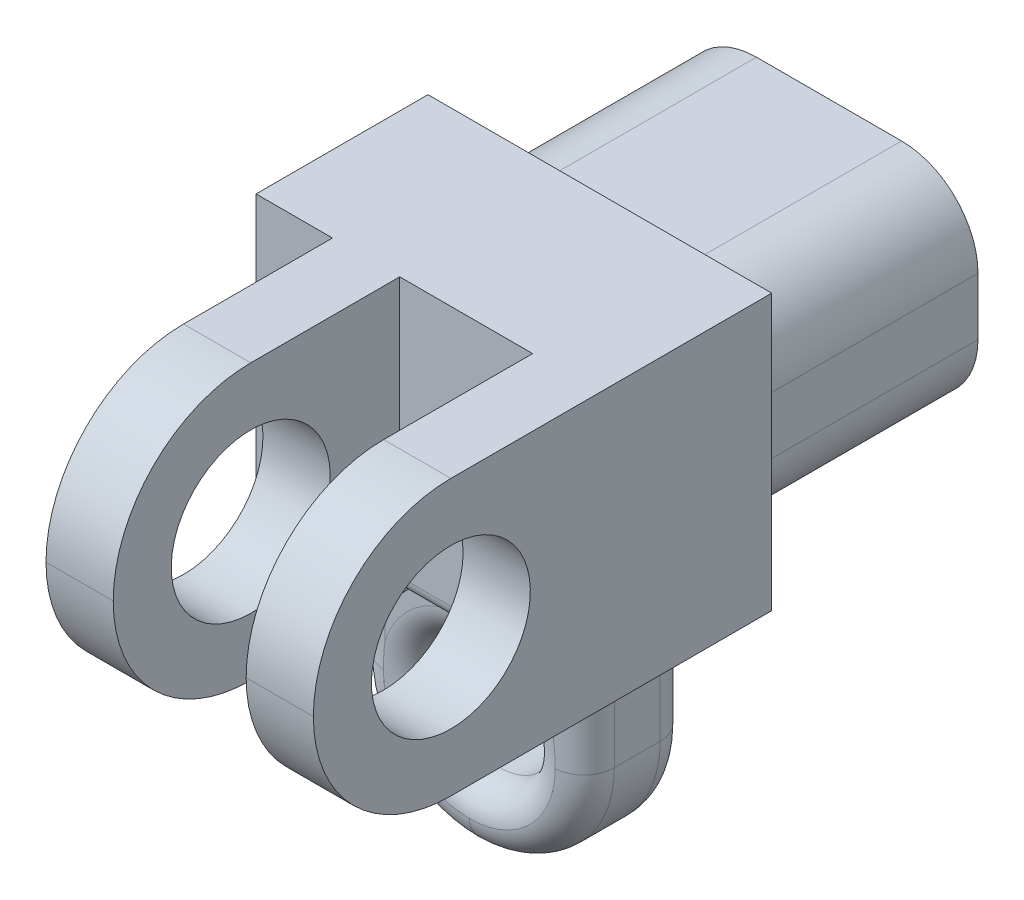
from build123d import *

# Parameters (mm, degrees)
SKETCH2_W           = 24.765
SKETCH2_H           = 17.4625
BOSS_EXTRUDE1_DEPTH = 19.05
SKETCH3_W           = 28.575
SKETCH3_H           = 22.86
BOSS_EXTRUDE2_DEPTH = 38.1
SKETCH4_W           = 6.35
SKETCH4_H           = 23.8125
SKETCH4_W_2         = 11.049
CUT_EXTRUDE1_DEPTH  = 47.6725
SKETCH5_W           = 19.05
SKETCH5_H           = 8.89
BOSS_EXTRUDE3_DEPTH = 19.05
FILLET1_R           = 9.525
SKETCH6_R           = 4.7625
CUT_EXTRUDE2_DEPTH  = 50.382672553
FILLET5_R           = 11.43
SKETCH7_R           = 6.604
CUT_EXTRUDE3_DEPTH  = 54.615212627
FILLET2_R           = 2.54
FILLET3_R           = 6.35
FILLET6_R           = 1.27


# Some blends are built 0.0001 mm under size
with BuildPart() as part:
    # Sketch2 → Boss-Extrude1 (new body)
    with BuildSketch(Plane.XY):
        Rectangle(SKETCH2_W, SKETCH2_H)
    extrude(amount=-BOSS_EXTRUDE1_DEPTH)

    # Sketch3 → Boss-Extrude2 (add)
    with BuildSketch(Plane.XY):
        Rectangle(SKETCH3_W, SKETCH3_H)
    extrude(amount=BOSS_EXTRUDE2_DEPTH)

    # Sketch4 → Cut-Extrude1 (cut, through all)
    with BuildSketch(Plane(origin=(0, -11.43, 0), x_dir=(-1, 0, 0), z_dir=(0, -1, 0))):
        with Locations((11.1125, -26.19375)):
            Rectangle(SKETCH4_W, SKETCH4_H)
        with Locations((-3.175, -26.19375)):
            Rectangle(SKETCH4_W_2, SKETCH4_H)
    extrude(amount=-CUT_EXTRUDE1_DEPTH, mode=Mode.SUBTRACT)

    # Sketch5 → Boss-Extrude3 (add)
    with BuildSketch(Plane.XZ.offset(11.43)):
        with Locations((0, 6.4135)):
            Rectangle(SKETCH5_W, SKETCH5_H)
    extrude(amount=BOSS_EXTRUDE3_DEPTH)

    # Fillet1
    fillet1_edges = [part.edges().sort_by_distance(p)[0] for p in [
        (9.525, -30.48, 6.4135),
        (-9.525, -30.48, 6.4135),
    ]]
    fillet(fillet1_edges, radius=FILLET1_R - 0.0001)  # a hair under: the kernel refuses the full size

    # Sketch6 → Cut-Extrude2 (cut, through all)
    with BuildSketch(Plane(origin=(0, 0, 1.9685), x_dir=(-1, 0, 0), z_dir=(0, 0, -1))):
        with Locations((0, -20.955)):
            Circle(SKETCH6_R)
    extrude(amount=-CUT_EXTRUDE2_DEPTH, mode=Mode.SUBTRACT)

    # Fillet5
    fillet5_edges = [part.edges().sort_by_distance(p)[0] for p in [
        (-5.1435, -11.43, 38.1),
        (-5.1435, 11.43, 38.1),
        (11.4935, 11.43, 38.1),
        (11.4935, -11.43, 38.1),
    ]]
    fillet(fillet5_edges, radius=FILLET5_R - 0.0001)  # a hair under: the kernel refuses the full size

    # Sketch7 → Cut-Extrude3 (cut, through all)
    with BuildSketch(Plane.ZY.offset(7.9375)):
        with Locations(Location((26.67, 0, 0), (0, 0, 270))):
            Circle(SKETCH7_R)
    extrude(amount=-CUT_EXTRUDE3_DEPTH, mode=Mode.SUBTRACT)

    # Fillet2
    # the kernel refuses this fillet: 2.54 mm, written as the material it takes off along each edge
    with BuildSketch(Plane(origin=(-9.525, -11.43, 10.8585), x_dir=(0, 0, -1), z_dir=(0, -1, 0))) as fillet2_piece_1:
        with BuildLine():
            CenterArc((FILLET2_R, FILLET2_R), FILLET2_R, 180, 90)
            Line((0, FILLET2_R), (0, 0))
            Line((0, 0), (FILLET2_R, 0))
        make_face()
    extrude(amount=9.5251, mode=Mode.SUBTRACT)
    with BuildSketch(Plane(origin=(9.525, -11.43, 10.8585), x_dir=(0, 0, -1), z_dir=(0, -1, 0)), Plane(origin=(9.525, -11.43, 1.9685), x_dir=(-1, 0, 0), z_dir=(0, -1, 0)), Plane(origin=(-9.525, -11.43, 1.9685), x_dir=(0, 0, 1), z_dir=(0, -1, 0))) as fillet2_piece_2:
        with BuildLine():
            CenterArc((FILLET2_R, -FILLET2_R), FILLET2_R, 90, 90)
            Line((0, -FILLET2_R), (0, 0))
            Line((0, 0), (FILLET2_R, 0))
        make_face()
    extrude(amount=9.5251, mode=Mode.SUBTRACT)
    with BuildSketch(Plane(origin=(-0.0001, -20.9551, 10.8585), x_dir=(-1, 0, 0), z_dir=(0, 1, 0))) as fillet2_piece_3:
        with BuildLine():
            CenterArc((9.5249 - FILLET2_R, -FILLET2_R), FILLET2_R, 360, 90)
            Line((9.5249, -FILLET2_R), (9.5249, 0))
            Line((9.5249, 0), (9.5249 - FILLET2_R, 0))
        make_face()
    revolve(axis=Axis((-0.0001, -20.9551, 10.8585), (0, 0, 1)), revolution_arc=90, mode=Mode.SUBTRACT)
    with BuildSketch(Plane(origin=(0.0001, -20.9551, 10.8585), x_dir=(1, 0, 0), z_dir=(0, 1, 0))) as fillet2_piece_4:
        with BuildLine():
            CenterArc((9.5249 - FILLET2_R, FILLET2_R), FILLET2_R, 270, 90)
            Line((9.5249, FILLET2_R), (9.5249, 0))
            Line((9.5249, 0), (9.5249 - FILLET2_R, 0))
        make_face()
    revolve(axis=Axis((0.0001, -20.9551, 10.8585), (0, 0, -1)), revolution_arc=90, mode=Mode.SUBTRACT)
    with BuildSketch(Plane(origin=(-0.0001, -20.9551, 1.9685), x_dir=(-1, 0, 0), z_dir=(0, 1, 0))) as fillet2_piece_5:
        with BuildLine():
            CenterArc((9.5249 - FILLET2_R, FILLET2_R), FILLET2_R, 270, 90)
            Line((9.5249, FILLET2_R), (9.5249, 0))
            Line((9.5249, 0), (9.5249 - FILLET2_R, 0))
        make_face()
    revolve(axis=Axis((-0.0001, -20.9551, 1.9685), (0, 0, 1)), revolution_arc=90, mode=Mode.SUBTRACT)
    with BuildSketch(Plane(origin=(0.0001, -20.9551, 1.9685), x_dir=(1, 0, 0), z_dir=(0, 1, 0))) as fillet2_piece_6:
        with BuildLine():
            CenterArc((9.5249 - FILLET2_R, -FILLET2_R), FILLET2_R, 0, 90)
            Line((9.5249, -FILLET2_R), (9.5249, 0))
            Line((9.5249, 0), (9.5249 - FILLET2_R, 0))
        make_face()
    revolve(axis=Axis((0.0001, -20.9551, 1.9685), (0, 0, -1)), revolution_arc=90, mode=Mode.SUBTRACT)
    with BuildSketch(Plane(origin=(0, -20.955, 10.8585), x_dir=(-1, 0, 0), z_dir=(0, -1, 0))) as fillet2_piece_7:
        with BuildLine():
            CenterArc((4.7625 + FILLET2_R, FILLET2_R), FILLET2_R, 180, 90)
            Line((4.7625, FILLET2_R), (4.7625, 0))
            Line((4.7625, 0), (4.7625 + FILLET2_R, 0))
        make_face()
    revolve(axis=Axis((0, -20.955, 10.8585), (0, 0, -1)), mode=Mode.SUBTRACT)
    with BuildSketch(Plane(origin=(0, -20.955, 1.9685), x_dir=(-1, 0, 0), z_dir=(0, -1, 0))) as fillet2_piece_8:
        with BuildLine():
            CenterArc((4.7625 + FILLET2_R, -FILLET2_R), FILLET2_R, 90, 90)
            Line((4.7625, -FILLET2_R), (4.7625, 0))
            Line((4.7625, 0), (4.7625 + FILLET2_R, 0))
        make_face()
    revolve(axis=Axis((0, -20.955, 1.9685), (0, 0, -1)), mode=Mode.SUBTRACT)
    with BuildSketch(Plane(origin=(0.0001, -30.48, 1.9685), x_dir=(0, 1, 0), z_dir=(-1, 0, 0)), Plane(origin=(-0.0001, -30.48, 10.8585), x_dir=(0, 1, 0), z_dir=(1, 0, 0))) as fillet2_piece_9:
        with BuildLine():
            CenterArc((FILLET2_R, -FILLET2_R), FILLET2_R, 90, 90)
            Line((0, -FILLET2_R), (0, 0))
            Line((0, 0), (FILLET2_R, 0))
        make_face()
    extrude(amount=0.0002, mode=Mode.SUBTRACT)

    # Fillet3
    fillet3_edges = [part.edges().sort_by_distance(p)[0] for p in [
        (-12.3825, 8.73125, -9.525),
        (12.3825, 8.73125, -9.525),
        (12.3825, -8.73125, -9.525),
        (-12.3825, -8.73125, -9.525),
    ]]
    fillet(fillet3_edges, radius=FILLET3_R)

    # Fillet6
    fillet6_edges = [part.edges().sort_by_distance(p)[0] for p in [
        (-11.1125, -11.43, 14.2875),
        (3.175, -11.43, 14.2875),
    ]]
    fillet(fillet6_edges, radius=FILLET6_R)


solid = part.part
